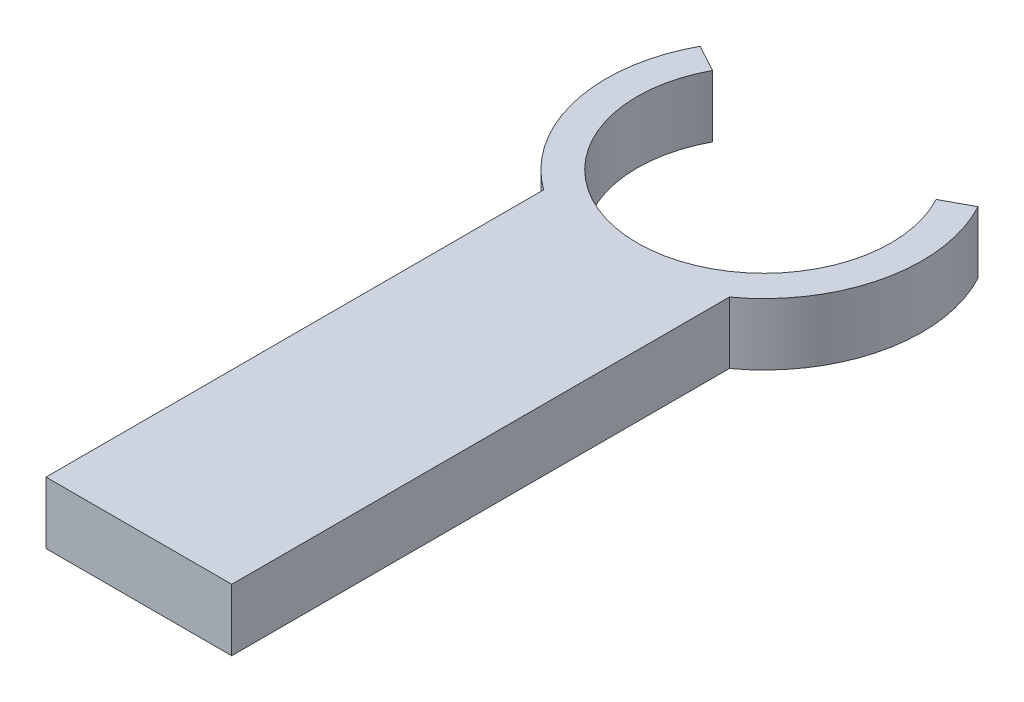
from build123d import *

# Parameters (mm, degrees)
BOSS_EXTRUDE1_DEPTH = 10


with BuildPart() as part:
    # Sketch1 → Boss-Extrude1 (new body)
    with BuildSketch(Plane(origin=(0, 0, 0), x_dir=(1, 0, 0), z_dir=(0, 1, 0))):
        with BuildLine():
            Line((-15, -101), (15, -101))
            Line((15, -101), (15.008684604, -20.615270711))
            ThreePointArc((15.008684604, -20.615270711), (24.864904124, -5.655664674), (22.448897698, 12.095329353))
            Line((22.448897698, 12.095329353), (18.047153051, 9.723696147))
            ThreePointArc((18.047153051, 9.723696147), (0, -20.5), (-18.047153051, 9.723696147))
            Line((-18.047153051, 9.723696147), (-22.448897698, 12.095329353))
            ThreePointArc((-22.448897698, 12.095329353), (-24.862520272, -5.666134989), (-14.991316761, -20.62790396))
            Line((-14.991316761, -20.62790396), (-15, -101))
        make_face()
    extrude(amount=BOSS_EXTRUDE1_DEPTH)


solid = part.part
